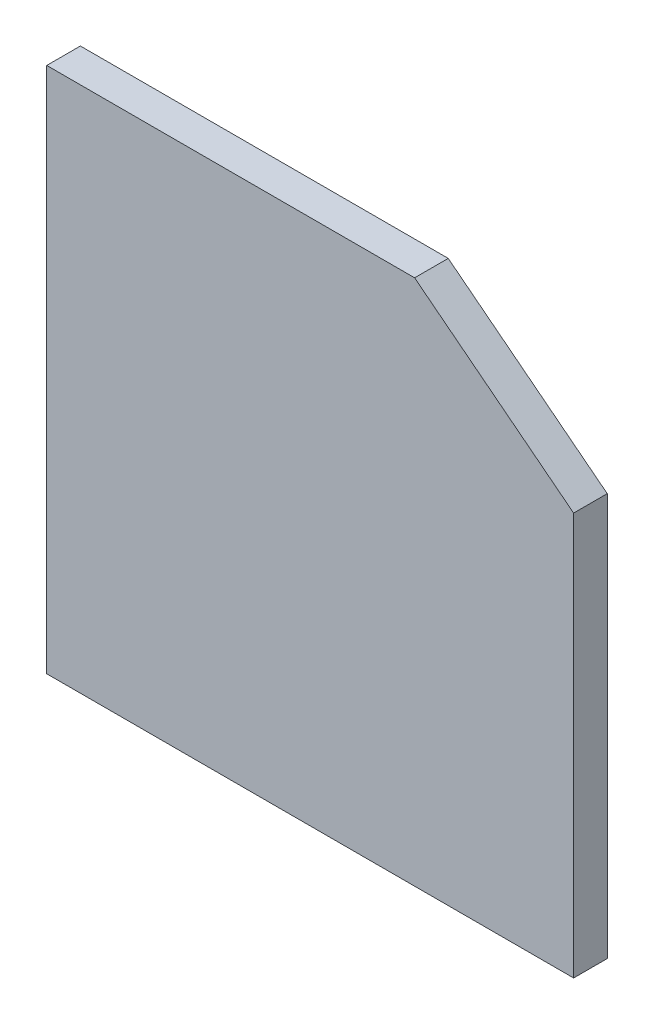
from build123d import *

# Parameters (mm, degrees)
BOSS_EXTRUDE1_DEPTH = 3


with BuildPart() as part:
    # Sketch1 → Boss-Extrude1 (new body)
    with BuildSketch(Plane.XY):
        Polygon((47, 35.918093444), (32.815806435, 47), (0, 47), (0, 0), (47, 0), align=None)
    extrude(amount=BOSS_EXTRUDE1_DEPTH)


solid = part.part
